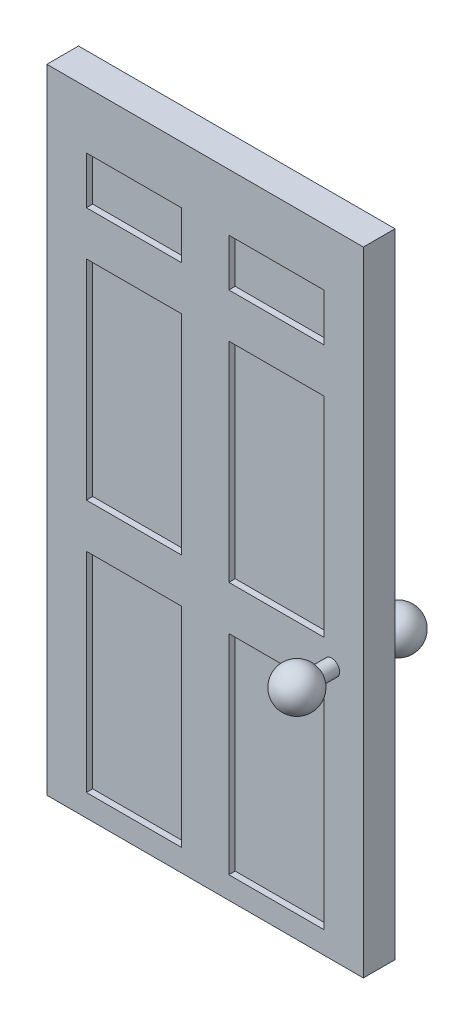
from build123d import *

# Parameters (mm, degrees)
SKETCH1_W           = 50
SKETCH1_H           = 100
BOSS_EXTRUDE1_DEPTH = 2.5
SKETCH2_R           = 1.25
BOSS_EXTRUDE2_DEPTH = 2.5
SKETCH4_W           = 15
SKETCH4_H           = 7.5
SKETCH4_H_2         = 33
CUT_EXTRUDE1_DEPTH  = 1


with BuildPart() as part:
    # Sketch1 → Boss-Extrude1 (new, symmetric)
    with BuildSketch(Plane.XY):
        Rectangle(SKETCH1_W, SKETCH1_H)
    extrude(amount=BOSS_EXTRUDE1_DEPTH, both=True)

    # Sketch2 → Boss-Extrude2 (add)
    with BuildSketch(Plane.XY.offset(2.5)):
        with Locations((20, -10)):
            Circle(SKETCH2_R)
    boss_extrude2 = extrude(amount=BOSS_EXTRUDE2_DEPTH)

    # Sketch3 → Revolve1 (revolve)
    with BuildSketch(Plane(origin=(20, 0, 0), x_dir=(0, 0, -1), z_dir=(1, 0, 0))):
        with BuildLine():
            Line((-8, -6.75), (-8, -13.25))
            ThreePointArc((-8, -13.25), (-11.25, -10), (-8, -6.75))
        make_face()
    revolve1 = revolve(axis=Axis((20, -6.75, 8), (0, -1, 0)))

    # Sketch4 → Cut-Extrude1 (cut)
    with BuildSketch(Plane.XY.offset(2.5)):
        with Locations((-11.25, 37.25)):
            Rectangle(SKETCH4_W, SKETCH4_H)
        with Locations((11.25, 37.25)):
            Rectangle(SKETCH4_W, SKETCH4_H)
        with Locations((11.25, 10)):
            Rectangle(SKETCH4_W, SKETCH4_H_2)
        with Locations((-11.25, 10)):
            Rectangle(SKETCH4_W, SKETCH4_H_2)
        with Locations((-11.25, -30)):
            Rectangle(SKETCH4_W, SKETCH4_H_2)
        with Locations((11.25, -30)):
            Rectangle(SKETCH4_W, SKETCH4_H_2)
    cut_extrude1 = extrude(amount=-CUT_EXTRUDE1_DEPTH, mode=Mode.SUBTRACT)

    # Mirror1: Boss-Extrude2, Revolve1, Cut-Extrude1 across plane
    add(boss_extrude2.mirror(Plane.XY))
    add(revolve1.mirror(Plane.XY))
    add(cut_extrude1.mirror(Plane.XY), mode=Mode.SUBTRACT)


solid = part.part
